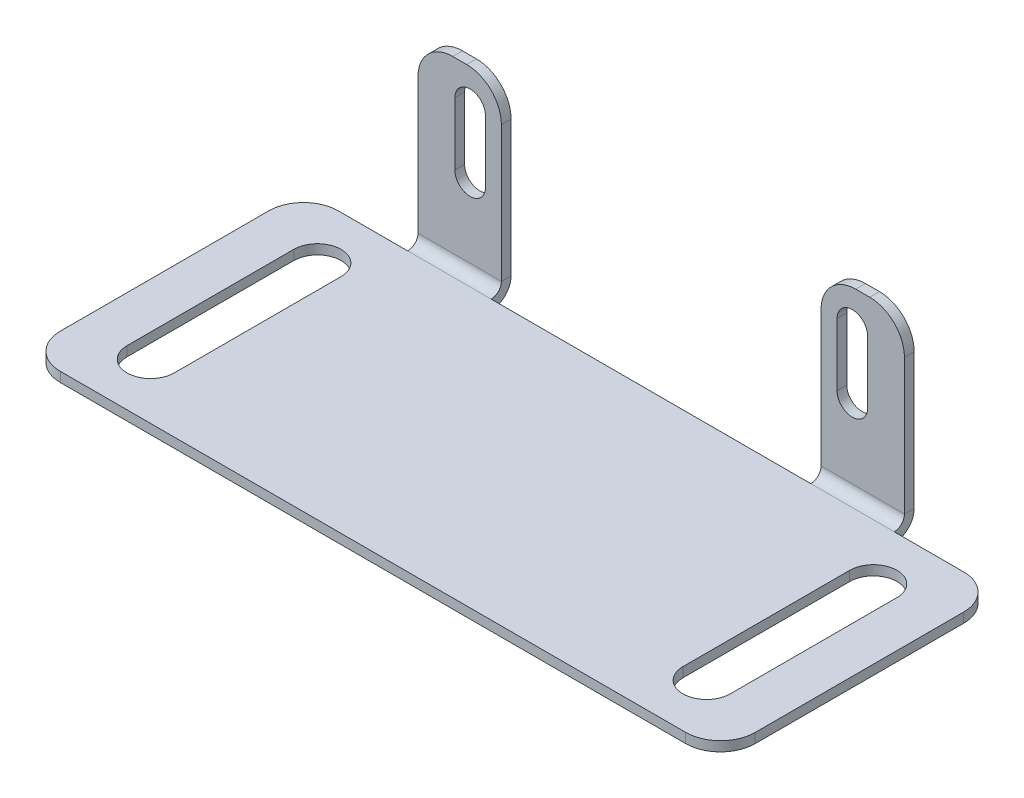
from build123d import *

# Parameters (mm, degrees)
SKETCH1_W             = 50
SKETCH1_H             = 20
BASE_FLANGE1_DEPTH    = 0.7
EDGE_FLANGE1_DEPTH    = 6
CUT_EXTRUDE1_REACH    = 37.405
BREAK_CORNER1_START   = -12
BREAK_CORNER1_DEPTH   = 2
BREAK_CORNER1_START_2 = -2
BREAK_CORNER1_2_DEPTH = 3
CUT_EXTRUDE2_REACH    = 32.41


with BuildPart() as part:
    # Base-Flange1: sheet metal written as solids
    # Sketch1 → Base-Flange1 (new body)
    with BuildSketch(Plane(origin=(0, 0, 0), x_dir=(1, 0, 0), z_dir=(0, 1, 0))):
        Rectangle(SKETCH1_W, SKETCH1_H)
    extrude(amount=-BASE_FLANGE1_DEPTH)

    # Edge-Flange1: sheet metal written as solids
    # Edge-Flange1 section (on a plane across the edge) → Edge-Flange1 (add)
    with BuildSketch(Plane(origin=(17.5, 0, -10.7366), x_dir=(0, 0, 1), z_dir=(-1, 0, 0))):
        with BuildLine():
            Line((-0.7, 0.7366), (-0.7, 13))
            Line((-0.7, 13), (0, 13))
            Line((0, 13), (0, 0.7366))
            ThreePointArc((0, 0.7366), (0.215745145, 0.215745145), (0.7366, 0))
            Line((0.7366, 0), (0.7366, -0.7))
            ThreePointArc((0.7366, -0.7), (-0.279229602, -0.279229602), (-0.7, 0.7366))
        make_face()
    edge_flange1 = extrude(amount=EDGE_FLANGE1_DEPTH)

    # Sketch7 → Cut-Extrude1 (cut, up to next)
    with BuildSketch(Plane(origin=(0, 0, -11.4366), x_dir=(-1, 0, 0), z_dir=(0, 0, -1)), mode=Mode.PRIVATE) as cut_extrude1_sk1:
        with BuildLine():
            Line((-12.65, 10.5), (-12.65, 6))
            ThreePointArc((-12.65, 6), (-13.75, 4.9), (-14.85, 6))
            Line((-14.85, 6), (-14.85, 10.5))
            ThreePointArc((-14.85, 10.5), (-13.75, 11.6), (-12.65, 10.5))
        make_face()
    cut_extrude1_tool1 = extrude(cut_extrude1_sk1.sketch, amount=-CUT_EXTRUDE1_REACH, mode=Mode.PRIVATE) & part.part
    cut_extrude1 = cut_extrude1_tool1.solids().sort_by_distance((13.75, 8.25, -11.4366))[0]
    add(cut_extrude1, mode=Mode.SUBTRACT)

    # Mirror1: Edge-Flange1, Cut-Extrude1 across plane
    add(edge_flange1.mirror(Plane(origin=(0, 0, 0), x_dir=(0, 0, 1), z_dir=(1, 0, 0))))
    add(cut_extrude1.mirror(Plane(origin=(0, 0, 0), x_dir=(0, 0, 1), z_dir=(1, 0, 0))), mode=Mode.SUBTRACT)

    # Break-Corner1: read off the stored shape, not the designer's step
    # Break-Corner1 outline → Break-Corner1 (cut)
    with BuildSketch(Plane.XY.offset(BREAK_CORNER1_START)):
        with BuildLine():
            ThreePointArc((-17.5, 10.5), (-16.767766953, 12.267766953), (-15, 13))
            Line((-15, 13), (-17.5, 13))
            Line((-17.5, 13), (-17.5, 10.5))
        make_face()
        with BuildLine():
            ThreePointArc((-14, 13), (-12.232233047, 12.267766953), (-11.5, 10.5))
            Line((-11.5, 10.5), (-11.5, 13))
            Line((-11.5, 13), (-14, 13))
        make_face()
        with BuildLine():
            ThreePointArc((11.5, 10.5), (12.232233047, 12.267766953), (14, 13))
            Line((14, 13), (11.5, 13))
            Line((11.5, 13), (11.5, 10.5))
        make_face()
        with BuildLine():
            ThreePointArc((15, 13), (16.767766953, 12.267766953), (17.5, 10.5))
            Line((17.5, 10.5), (17.5, 13))
            Line((17.5, 13), (15, 13))
        make_face()
    extrude(amount=BREAK_CORNER1_DEPTH, mode=Mode.SUBTRACT)

    # Break-Corner1 2 outline → Break-Corner1 2 (cut)
    with BuildSketch(Plane(origin=(0, 0, 0), x_dir=(1, 0, 0), z_dir=(0, 1, 0)).offset(BREAK_CORNER1_START_2)):
        with BuildLine():
            ThreePointArc((22.5, 10), (24.267766953, 9.267766953), (25, 7.5))
            Line((25, 7.5), (25, 10))
            Line((25, 10), (22.5, 10))
        make_face()
        with BuildLine():
            Line((-25, 10), (-25, 7.5))
            ThreePointArc((-25, 7.5), (-24.267766953, 9.267766953), (-22.5, 10))
            Line((-22.5, 10), (-25, 10))
        make_face()
        with BuildLine():
            Line((-25, -10), (-22.5, -10))
            ThreePointArc((-22.5, -10), (-24.267766953, -9.267766953), (-25, -7.5))
            Line((-25, -7.5), (-25, -10))
        make_face()
        with BuildLine():
            ThreePointArc((25, -7.5), (24.267766953, -9.267766953), (22.5, -10))
            Line((22.5, -10), (25, -10))
            Line((25, -10), (25, -7.5))
        make_face()
    extrude(amount=BREAK_CORNER1_2_DEPTH, mode=Mode.SUBTRACT)

    # Sketch8 → Cut-Extrude2 (cut, up to next)
    with BuildSketch(Plane(origin=(0, 0, 0), x_dir=(1, 0, 0), z_dir=(0, 1, 0)), mode=Mode.PRIVATE) as cut_extrude2_sk1:
        with BuildLine():
            Line((-18.3, 6), (-18.3, -6))
            ThreePointArc((-18.3, -6), (-20, -7.7), (-21.7, -6))
            Line((-21.7, -6), (-21.7, 6))
            ThreePointArc((-21.7, 6), (-20, 7.7), (-18.3, 6))
        make_face()
    cut_extrude2_tool1 = extrude(cut_extrude2_sk1.sketch, amount=-CUT_EXTRUDE2_REACH, mode=Mode.PRIVATE) & part.part
    # Sketch8 → Cut-Extrude2 (cut, up to next)
    with BuildSketch(Plane(origin=(0, 0, 0), x_dir=(1, 0, 0), z_dir=(0, 1, 0)), mode=Mode.PRIVATE) as cut_extrude2_sk2:
        with BuildLine():
            Line((18.3, 6), (18.3, -6))
            ThreePointArc((18.3, -6), (20, -7.7), (21.7, -6))
            Line((21.7, -6), (21.7, 6))
            ThreePointArc((21.7, 6), (20, 7.7), (18.3, 6))
        make_face()
    cut_extrude2_tool2 = extrude(cut_extrude2_sk2.sketch, amount=-CUT_EXTRUDE2_REACH, mode=Mode.PRIVATE) & part.part
    add(cut_extrude2_tool1.solids().sort_by_distance((-20, 0, 0))[0], mode=Mode.SUBTRACT)
    add(cut_extrude2_tool2.solids().sort_by_distance((20, 0, 0))[0], mode=Mode.SUBTRACT)


solid = part.part
